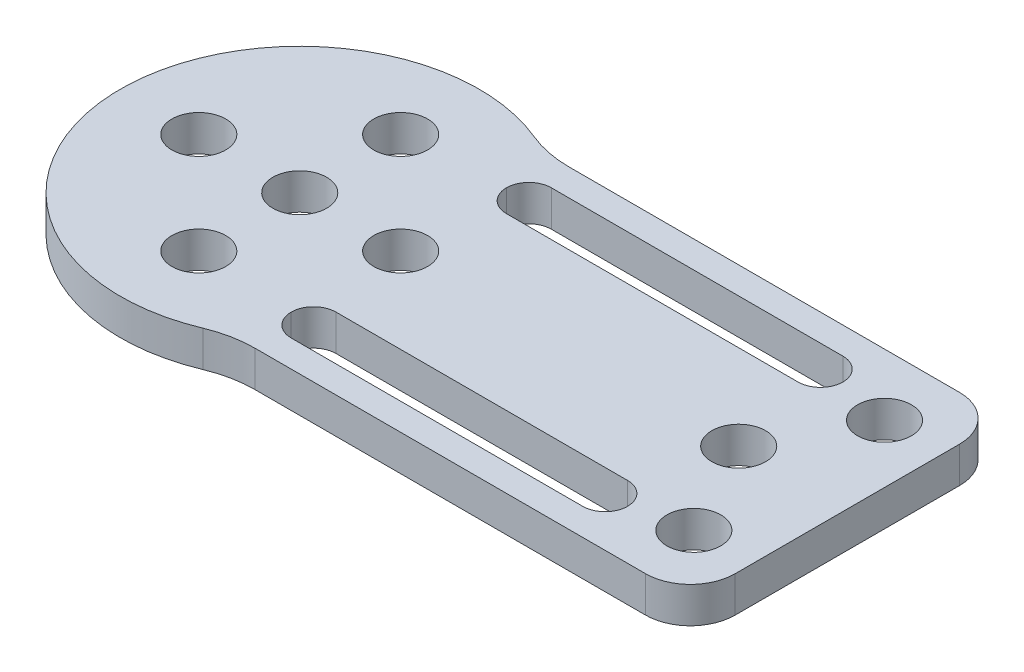
from build123d import *

# Parameters (mm, degrees)
BOSS_EXTRUDE1_DEPTH = 0.8
FILLET1_R           = 2
FILLET2_R           = 5
SKETCH2_R           = 1.2
CUT_EXTRUDE1_DEPTH  = 23.249719099
SKETCH3_R           = 1.2
CUT_EXTRUDE2_DEPTH  = 23.249719099
SKETCH5_W           = 15
SKETCH5_H           = 2
CUT_EXTRUDE3_DEPTH  = 23.249719099
FILLET3_R           = 1


with BuildPart() as part:
    # Sketch1 → Boss-Extrude1 (new, symmetric)
    with BuildSketch(Plane(origin=(0, 0, 0), x_dir=(1, 0, 0), z_dir=(0, 1, 0))):
        with BuildLine():
            Line((11.716387939, 7), (-8.827016654, 7))
            ThreePointArc((-8.827016654, 7), (-20.7, 0), (-8.827016654, -7))
            Line((-8.827016654, -7), (11.716387939, -7))
            Line((11.716387939, -7), (11.716387939, 7))
        make_face()
    extrude(amount=BOSS_EXTRUDE1_DEPTH, both=True)

    # Fillet1
    fillet1_edges = [part.edges().sort_by_distance(p)[0] for p in [
        (11.716387939, 0, 7),
        (11.716387939, 0, -7),
    ]]
    fillet(fillet1_edges, radius=FILLET1_R)

    # Fillet2
    fillet2_edges = [part.edges().sort_by_distance(p)[0] for p in [
        (-8.827016654, 0, 7),
        (-8.827016654, 0, -7),
    ]]
    fillet(fillet2_edges, radius=FILLET2_R)

    # Sketch2 → Cut-Extrude1 (cut, through all)
    with BuildSketch(Plane(origin=(0, 0.8, 0), x_dir=(1, 0, 0), z_dir=(0, 1, 0))):
        with Locations(Location((-8.2, 0, 0), (0, 0, 270))):
            Circle(SKETCH2_R)
        with Locations(Location((-12.7, 4.5, 0), (0, 0, 270))):
            Circle(SKETCH2_R)
        with Locations(Location((-17.2, 0, 0), (0, 0, 270))):
            Circle(SKETCH2_R)
        with Locations(Location((-12.7, -4.5, 0), (0, 0, 270))):
            Circle(SKETCH2_R)
        with Locations(Location((-12.7, 0, 0), (0, 0, 270))):
            Circle(SKETCH2_R)
    extrude(amount=-CUT_EXTRUDE1_DEPTH, mode=Mode.SUBTRACT)

    # Sketch3 → Cut-Extrude2 (cut, through all)
    with BuildSketch(Plane(origin=(0, 0.8, 0), x_dir=(1, 0, 0), z_dir=(0, 1, 0))):
        with Locations(Location((9.121387939, 4.25, 0), (0, 0, 270))):
            Circle(SKETCH3_R)
        with Locations(Location((9.121387939, -4.25, 0), (0, 0, 270))):
            Circle(SKETCH3_R)
        with Locations(Location((6.871387939, 0, 0), (0, 0, 270))):
            Circle(SKETCH3_R)
    extrude(amount=-CUT_EXTRUDE2_DEPTH, mode=Mode.SUBTRACT)

    # Sketch5 → Cut-Extrude3 (cut, through all)
    with BuildSketch(Plane(origin=(0, 0.8, 0), x_dir=(1, 0, 0), z_dir=(0, 1, 0))):
        with Locations((-0.783612061, 4.8)):
            Rectangle(SKETCH5_W, SKETCH5_H)
        with Locations((-0.783612061, -4.8)):
            Rectangle(SKETCH5_W, SKETCH5_H)
    extrude(amount=-CUT_EXTRUDE3_DEPTH, mode=Mode.SUBTRACT)

    # Fillet3
    fillet3_edges = [part.edges().sort_by_distance(p)[0] for p in [
        (-8.283612061, 0, 5.8),
        (6.716387939, 0, 5.8),
        (6.716387939, 0, 3.8),
        (-8.283612061, 0, 3.8),
        (-8.283612061, 0, -3.8),
        (6.716387939, 0, -3.8),
        (6.716387939, 0, -5.8),
        (-8.283612061, 0, -5.8),
    ]]
    fillet(fillet3_edges, radius=FILLET3_R - 0.0001)  # a hair under: the kernel refuses the full size


solid = part.part
